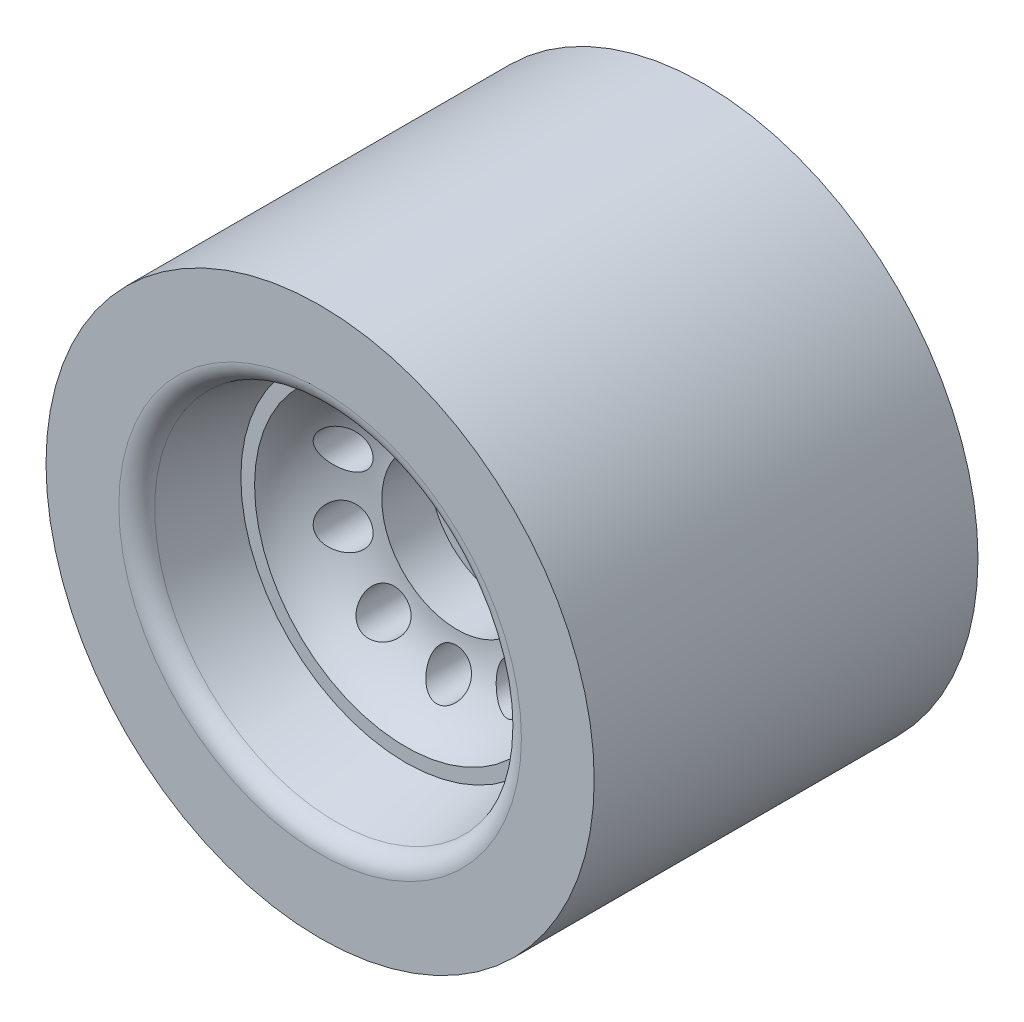
from build123d import *

# Parameters (mm, degrees)
SKETCH_1_R               = 40
EXTRUDE_1_DEPTH          = 28
SKETCH_2_R               = 5
CUT_EXTRUDE_1_DEPTH      = 80.598994969
SKETCH_5_R               = 3
CUT_EXTRUDE_2_DEPTH      = 64.118935352
PATTERN_CIRCULAR_1_COUNT = 10
FILLET_1_R               = 3
SKETCH_6_R               = 11
CUT_EXTRUDE_3_DEPTH      = 7
CUT_EXTRUDE_START        = -7
SKETCH_7_R               = 11
CUT_EXTRUDE_4_DEPTH      = 7


with BuildPart() as part:
    # 스케치1 → 보스-돌출1 (new, symmetric)
    with BuildSketch(Plane.XY):
        Circle(SKETCH_1_R)
    extrude(amount=EXTRUDE_1_DEPTH, both=True)

    # 스케치2 → 컷-돌출1 (cut, through all)
    with BuildSketch(Plane.XY.offset(28)):
        Circle(SKETCH_2_R)
    extrude(amount=-CUT_EXTRUDE_1_DEPTH, mode=Mode.SUBTRACT)

    # 스케치4 → 컷-회전1 (revolve, cut)
    with BuildSketch(Plane(origin=(0, 0, 0), x_dir=(0, 0, -1), z_dir=(1, 0, 0))):
        with BuildLine():
            Line((28, 40), (26.6, 33.9))
            Line((26.6, 33.9), (25.6, 33.4))
            ThreePointArc((25.6, 33.4), (24.889622908, 30.979101484), (23.906743999, 28.655454719))
            ThreePointArc((23.906743999, 28.655454719), (22.637634189, 25.439512152), (21.9083716, 22.06))
            ThreePointArc((21.9083716, 22.06), (16.454433029, 17.683921829), (14.4, 11))
            Line((14.4, 11), (14.4, 0))
            Line((14.4, 0), (28, 0))
            Line((28, 0), (28, 40))
        make_face()
        with BuildLine():
            Line((-28, 0), (-28, 27))
            Line((-28, 27), (-15.5083716, 24.06))
            Line((-15.5083716, 24.06), (-15.5083716, 22.06))
            ThreePointArc((-15.5083716, 22.06), (-10.054433029, 17.683921829), (-8, 11))
            Line((-8, 11), (-8, 0))
            Line((-8, 0), (-28, 0))
        make_face()
    revolve(axis=Axis((0, 0, -28), (0, 0, 1)), mode=Mode.SUBTRACT)

    # 스케치5 → 컷-돌출2 (cut, symmetric)
    with BuildSketch(Plane.XY):
        with Locations((0, 15.875)):
            Circle(SKETCH_5_R)
    cut_extrude_2 = extrude(amount=CUT_EXTRUDE_2_DEPTH, both=True, mode=Mode.SUBTRACT)

    # 원형 패턴1: 컷-돌출2 ×10 about axis
    pattern_circular_1_axis = Axis((0, 0, -28), (0, 0, 1))
    for i in range(1, PATTERN_CIRCULAR_1_COUNT):
        add(cut_extrude_2.rotate(pattern_circular_1_axis, i * 360 / PATTERN_CIRCULAR_1_COUNT), mode=Mode.SUBTRACT)

    # 필렛1
    fillet_1_edges = [part.edges().sort_by_distance(p)[0] for p in [
        (0, -27, 28),
    ]]
    fillet(fillet_1_edges, radius=FILLET_1_R)

    # 스케치6 → 컷-돌출3 (cut)
    with BuildSketch(Plane.XY.offset(8)):
        Circle(SKETCH_6_R)
    extrude(amount=-CUT_EXTRUDE_3_DEPTH, mode=Mode.SUBTRACT)

    # 스케치7 → 컷-돌출4 (cut)
    with BuildSketch(Plane(origin=(0, 0, -14.4), x_dir=(-1, 0, 0), z_dir=(0, 0, -1)).offset(CUT_EXTRUDE_START)):
        Circle(SKETCH_7_R)
    extrude(amount=CUT_EXTRUDE_4_DEPTH, mode=Mode.SUBTRACT)


solid = part.part
